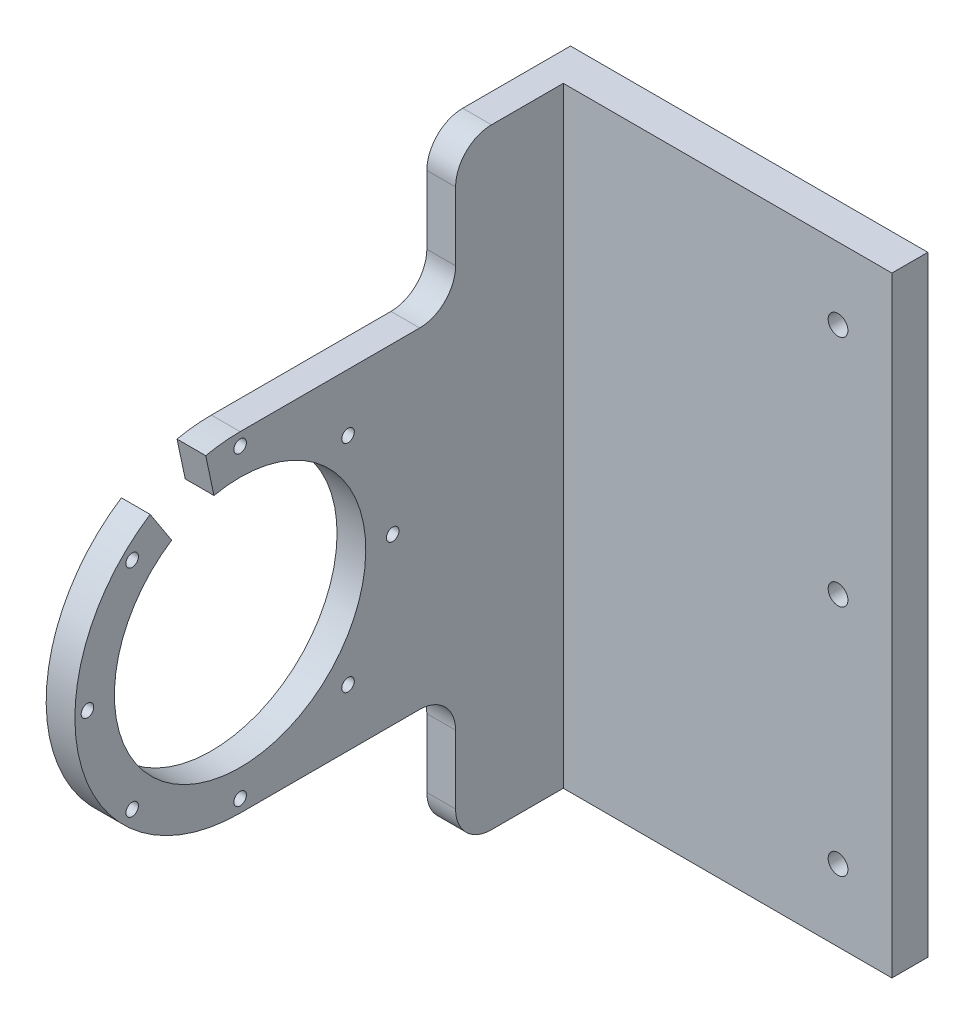
from build123d import *

# Parameters (mm, degrees)
EXTRUDE_1_DEPTH     = 170
SKETCH_2_R          = 35
CUT_EXTRUDE_1_DEPTH = 180
SKETCH_5_W          = 10
SKETCH_5_H          = 170
EXTRUDE_3_DEPTH     = 101.5
SKETCH_6_R          = 2.75
CUT_EXTRUDE_3_DEPTH = 52
FILLET_2_R          = 10
SKETCH_11_R         = 1.75
CUT_EXTRUDE_5_DEPTH = 10
CUT_EXTRUDE_6_DEPTH = 13
MOVE_FACE_2_BY      = 10


with BuildPart() as part:
    # 草图1 → 凸台-拉伸1 (new body)
    with BuildSketch(Plane(origin=(0, 0, 0), x_dir=(1, 0, 0), z_dir=(0, 1, 0))):
        Polygon((8, -10), (8, -300), (0, -300), (0, 0), (8, 0), align=None)
    extrude(amount=EXTRUDE_1_DEPTH)

    # 草图2 → 切除-拉伸1 (cut)
    with BuildSketch(Plane(origin=(8, 0, 0), x_dir=(0, 0, -1), z_dir=(1, 0, 0))):
        with Locations((-100, 85)):
            Circle(SKETCH_2_R)
        with BuildLine():
            Line((-100, 131), (-40, 131))
            Line((-40, 131), (-40, 170))
            Line((-40, 170), (-300, 170))
            Line((-300, 170), (-300, 0))
            Line((-300, 0), (-40, 0))
            Line((-40, 0), (-40, 39))
            Line((-40, 39), (-100, 39))
            ThreePointArc((-100, 39), (-146, 85), (-100, 131))
        make_face()
    extrude(amount=-CUT_EXTRUDE_1_DEPTH, mode=Mode.SUBTRACT)

    # 草图5 → 凸台-拉伸3 (add)
    with BuildSketch(Plane(origin=(8, 0, 0), x_dir=(0, 0, -1), z_dir=(1, 0, 0))):
        with Locations((-5, 85)):
            Rectangle(SKETCH_5_W, SKETCH_5_H)
    extrude(amount=EXTRUDE_3_DEPTH)

    # 草图6 → 切除-拉伸3 (cut)
    with BuildSketch(Plane(origin=(0, 0, 0), x_dir=(-1, 0, 0), z_dir=(0, 0, -1))):
        with Locations((-84.5, 150)):
            Circle(SKETCH_6_R)
        with Locations((-84.5, 20)):
            Circle(SKETCH_6_R)
        with Locations((-84.5, 85)):
            Circle(SKETCH_6_R)
    extrude(amount=-CUT_EXTRUDE_3_DEPTH, mode=Mode.SUBTRACT)

    # 圆角2
    fillet_2_edges = [part.edges().sort_by_distance(p)[0] for p in [
        (4, 170, 40),
        (4, 131, 40),
        (4, 0, 40),
        (4, 39, 40),
    ]]
    fillet(fillet_2_edges, radius=FILLET_2_R)

    # 草图11 → 切除-拉伸5 (cut)
    with BuildSketch(Plane.ZY):
        with Locations((100, 42.5)):
            Circle(SKETCH_11_R)
        with Locations((69.9479618, 54.9479618)):
            Circle(SKETCH_11_R)
        with Locations((57.5, 85)):
            Circle(SKETCH_11_R)
        with Locations((69.9479618, 115.0520382)):
            Circle(SKETCH_11_R)
        with Locations((100, 127.5)):
            Circle(SKETCH_11_R)
        with Locations((130.0520382, 115.0520382)):
            Circle(SKETCH_11_R)
        with Locations((142.5, 85)):
            Circle(SKETCH_11_R)
        with Locations((130.0520382, 54.9479618)):
            Circle(SKETCH_11_R)
    extrude(amount=-CUT_EXTRUDE_5_DEPTH, mode=Mode.SUBTRACT)

    # 草图12 → 切除-拉伸6 (cut)
    with BuildSketch(Plane.ZY):
        with BuildLine():
            Line((100, 85), (110.395584541, 133.907380037))
            ThreePointArc((110.395584541, 133.907380037), (119.134171618, 131.193976626), (127.231951751, 126.933528397))
            Line((127.231951751, 126.933528397), (100, 85))
        make_face()
    extrude(amount=-CUT_EXTRUDE_6_DEPTH, mode=Mode.SUBTRACT)

    # Move Face 2: a face moved inward by 10.0
    extrude(part.faces().sort_by_distance((109.5, 85, 5))[0], amount=MOVE_FACE_2_BY, dir=(-1, 0, 0), mode=Mode.SUBTRACT)


solid = part.part
